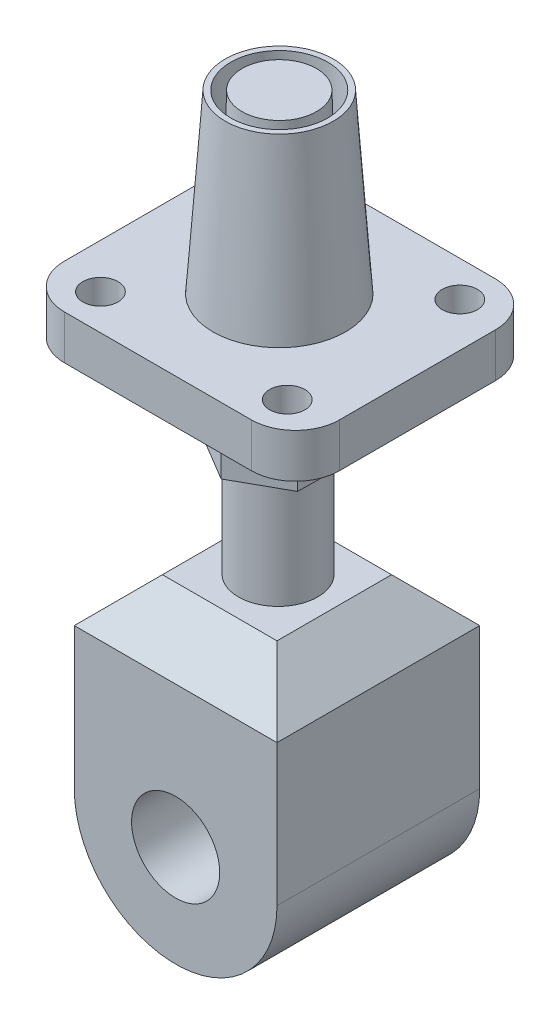
from build123d import *

# Parameters (mm, degrees)
SKETCH1_R           = 10
SKETCH1_W           = 46
SKETCH1_H           = 19.048435613
BOSS_EXTRUDE1_DEPTH = 46
CHAMFER1_SIZE       = 10
SKETCH2_R           = 9
BOSS_EXTRUDE2_DEPTH = 46
BOSS_EXTRUDE4_DEPTH = 10
SKETCH6_R           = 9.525638377
BOSS_EXTRUDE5_DEPTH = 10
SKETCH8_R           = 8.459669001
BOSS_EXTRUDE6_DEPTH = 50
DRAFT1_ANGLE        = 1
SKETCH9_R           = 14
SKETCH9_R_2         = 11
BOSS_EXTRUDE8_DEPTH = 40
DRAFT10_ANGLE       = 1.5
SKETCH12_W          = 62.404350154
SKETCH12_H          = 55.405731445
BOSS_EXTRUDE9_DEPTH = 10
FILLET1_R           = 10
FILLET2_R           = 10
SKETCH13_R          = 4
CUT_EXTRUDE3_DEPTH  = 10
DRAFT11_ANGLE       = 2
DRAFT12_ANGLE       = 4
DRAFT13_ANGLE       = 1
DRAFT14_ANGLE       = 1.5


# Read off the part's stored shape, not the designer's step: Draft7, Draft16
with BuildPart() as part:
    # Sketch1 → Boss-Extrude1 (new body)
    # profile 1 of 2: a face of its own
    with BuildSketch(Plane.XY):
        with BuildLine():
            Line((-23, 23), (-23, 0))
            ThreePointArc((-23, 0), (0, -23), (23, 0))
            Line((23, 0), (23, 23))
            Line((23, 23), (-23, 23))
        make_face()
        Circle(SKETCH1_R, mode=Mode.SUBTRACT)
    # profile 2 of 2: a face of its own
    with BuildSketch(Plane.XY):
        with Locations((0, 32.524217807)):
            Rectangle(SKETCH1_W, SKETCH1_H)
    extrude(amount=BOSS_EXTRUDE1_DEPTH)

    # Chamfer1
    chamfer1_edges = [part.edges().sort_by_distance(p)[0] for p in [
        (-23, 42.048435613, 23),
        (23, 42.048435613, 23),
        (0, 42.048435613, 46),
        (0, 42.048435613, 0),
    ]]
    chamfer(chamfer1_edges, length=CHAMFER1_SIZE)

    # Sketch2 → Boss-Extrude2 (add)
    with BuildSketch(Plane(origin=(0, 21.024217806, 0), x_dir=(1, 0, 0), z_dir=(0, 1, 0))):
        with Locations(Location((0, -22.756992406, 0), (0, 0, 270))):
            Circle(SKETCH2_R)
    extrude(amount=BOSS_EXTRUDE2_DEPTH)

    # Sketch5 → Boss-Extrude4 (add)
    with BuildSketch(Plane(origin=(0, 67.024217806, 0), x_dir=(1, 0, 0), z_dir=(0, 1, 0))):
        Polygon((10.943751373, -29.282952175), (11.123522631, -16.542405589), (0.179771258, -10.01644582), (-10.943751373, -16.231032637), (-11.123522631, -28.971579223), (-0.179771258, -35.497538992), align=None)
    extrude(amount=BOSS_EXTRUDE4_DEPTH)

    # Sketch6 → Boss-Extrude5 (add)
    with BuildSketch(Plane(origin=(0, 77.024217806, 0), x_dir=(1, 0, 0), z_dir=(0, 1, 0))):
        with Locations(Location((0, -22.484455751, 0), (0, 0, 270))):
            Circle(SKETCH6_R)
    extrude(amount=BOSS_EXTRUDE5_DEPTH)

    # Sketch8 → Boss-Extrude6 (add)
    with BuildSketch(Plane(origin=(0, 87.024217806, 0), x_dir=(1, 0, 0), z_dir=(0, 1, 0))):
        with Locations(Location((0, -22.484455751, 0), (0, 0, 270))):
            Circle(SKETCH8_R)
    extrude(amount=BOSS_EXTRUDE6_DEPTH)

    # Draft1
    draft1_faces = [part.faces().sort_by_distance(p)[0] for p in [
        (0, 112.024217806, 14.02478675),
    ]]
    draft(draft1_faces, Plane(origin=(0, 137.024217806, 22.484455751), x_dir=(0, 0, 1), z_dir=(0, 1, 0)), DRAFT1_ANGLE)

    # Draft7 outline → Draft7 (revolve)
    with BuildSketch(Plane.XY.offset(22.484455751)):
        Polygon((9.525638377, 87.024217806), (9.525638377, 96.316489669), (8.459669001, 137.024217806), (9.332422247, 87.024217806), align=None)
    revolve(axis=Axis((0, 0, 22.484455751), (0, 1, 0)))



with BuildPart() as body_2:
    # Sketch9 → Boss-Extrude8 (new body)
    with BuildSketch(Plane(origin=(0, 137.024217806, 0), x_dir=(1, 0, 0), z_dir=(0, 1, 0))):
        with Locations(Location((0, -22.484455751, 0), (0, 0, 270))):
            Circle(SKETCH9_R)
        with Locations(Location((0, -22.484455751, 0), (0, 0, 270))):
            Circle(SKETCH9_R_2, mode=Mode.SUBTRACT)
    extrude(amount=-BOSS_EXTRUDE8_DEPTH)

    # Draft10
    draft10_faces = [body_2.faces().sort_by_distance(p)[0] for p in [
        (0, 117.024217806, 8.484455751),
    ]]
    draft(draft10_faces, Plane(origin=(0, 137.024217806, 22.484455751), x_dir=(0, 0, 1), z_dir=(0, 1, 0)), DRAFT10_ANGLE)


with BuildPart() as part_1:
    add(part.part)

    add(body_2.part)  # Boss-Extrude9 merges body 2
    # Sketch12 → Boss-Extrude9 (add)
    with BuildSketch(Plane(origin=(0, 97.024217806, 0), x_dir=(-1, 0, 0), z_dir=(0, -1, 0))):
        with Locations((-0.437413669, -22.756992406)):
            Rectangle(SKETCH12_W, SKETCH12_H)
    extrude(amount=BOSS_EXTRUDE9_DEPTH)

    # Fillet1
    fillet1_edges = [part_1.edges().sort_by_distance(p)[0] for p in [
        (-30.764761408, 92.024217806, 50.459858128),
        (31.639588746, 92.024217806, -4.945873317),
        (31.639588746, 92.024217806, 50.459858128),
    ]]
    fillet(fillet1_edges, radius=FILLET1_R)

    # Fillet2
    fillet2_edges = [part_1.edges().sort_by_distance(p)[0] for p in [
        (-30.764761408, 92.024217806, -4.945873317),
    ]]
    fillet(fillet2_edges, radius=FILLET2_R)

    # Sketch13 → Cut-Extrude3 (cut)
    with BuildSketch(Plane(origin=(0, 97.024217806, 0), x_dir=(1, 0, 0), z_dir=(0, 1, 0))):
        with Locations(Location((-20.652282418, -42.41614068, 0), (0, 0, 270))):
            Circle(SKETCH13_R)
        with Locations(Location((21.744824706, -42.41614068, 0), (0, 0, 270))):
            Circle(SKETCH13_R)
        with Locations(Location((-20.652282418, -3.159218326, 0), (0, 0, 270))):
            Circle(SKETCH13_R)
        with Locations(Location((21.639588746, -3.159218326, 0), (0, 0, 270))):
            Circle(SKETCH13_R)
    extrude(amount=-CUT_EXTRUDE3_DEPTH, mode=Mode.SUBTRACT)

    # Draft11
    draft11_faces = [part_1.faces().sort_by_distance(p)[0] for p in [
        (0, 117.024217806, 7.960737319),
    ]]
    draft(draft11_faces, Plane(origin=(0, 137.024217806, 22.484455751), x_dir=(0, 0, 1), z_dir=(0, 1, 0)), DRAFT11_ANGLE)

    # Draft12
    draft12_faces = [part_1.faces().sort_by_distance(p)[0] for p in [
        (0, 117.024217806, 7.786040361),
    ]]
    draft(draft12_faces, Plane(origin=(0, 137.024217806, 22.484455751), x_dir=(0, 0, 1), z_dir=(0, 1, 0)), DRAFT12_ANGLE)

    # Draft13
    draft13_faces = [part_1.faces().sort_by_distance(p)[0] for p in [
        (0, 117.024217806, 7.085919512),
    ]]
    draft(draft13_faces, Plane(origin=(0, 137.024217806, 22.484455751), x_dir=(0, 0, 1), z_dir=(0, 1, 0)), DRAFT13_ANGLE)

    # Draft14
    draft14_faces = [part_1.faces().sort_by_distance(p)[0] for p in [
        (0, 117.024217806, 8.135354452),
    ]]
    draft(draft14_faces, Plane(origin=(0, 137.024217806, 22.484455751), x_dir=(0, 0, 1), z_dir=(0, 1, 0)), DRAFT14_ANGLE)

    # Draft16 outline → Draft16 (revolve, cut)
    with BuildSketch(Plane.XY.offset(22.484455751)):
        Polygon((14, 137.024217806), (12.250364385, 137.024217806), (15.047436863, 97.024217806), align=None)
    revolve(axis=Axis((0, 0, 22.484455751), (0, 1, 0)), mode=Mode.SUBTRACT)


solid = part_1.part
